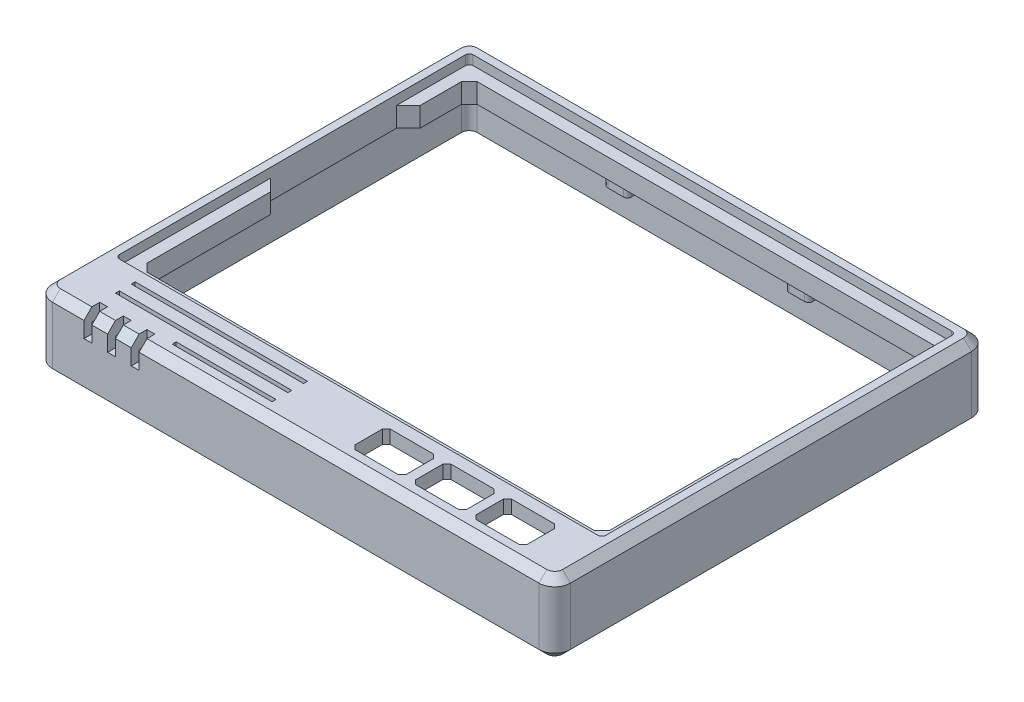
from build123d import *

# Parameters (mm, degrees)
SKETCH_1_W           = 65.76
SKETCH_1_H           = 54.92
EXTRUDE_1_DEPTH      = 9.3
FILLET_1_R           = 2
CUT_EXTRUDE_1_DEPTH  = 1.2
SKETCH_3_W           = 58.75
SKETCH_3_H           = 41.92
CUT_EXTRUDE_2_DEPTH  = 1
CHAMFER_2_SIZE       = 1
SKETCH_7_W           = 2
SKETCH_7_H           = 41.92
CUT_EXTRUDE_5_DEPTH  = 48.162577855
CUT_EXTRUDE_6_DEPTH  = 5.8
SKETCH_10_W          = 1.5
SKETCH_10_H          = 22.23
CUT_EXTRUDE_7_DEPTH  = 1
CHAMFER_8_SIZE       = 3
CHAMFER_9_SIZE       = 1
FILLET_2_R           = 2
CHAMFER_11_SIZE      = 1
FILLET_3_R           = 1
SKETCH_14_W          = 12.681422007
SKETCH_14_H          = 0.5
SKETCH_14_W_2        = 21.88
SKETCH_14_W_3        = 6.5
SKETCH_14_H_2        = 4.5
CUT_EXTRUDE_9_DEPTH  = 48.543545828
CHAMFER_14_SIZE      = 0.5
SKETCH_14_3_W        = 1
SKETCH_14_3_H        = 2
CUT_EXTRUDE_10_DEPTH = 3
CUT_EXTRUDE_11_DEPTH = 1.8
EXTRUDE_3_DEPTH      = 2
FILLET_5_R           = 1
SKETCH_23_R          = 1
CUT_EXTRUDE_14_DEPTH = 2
SKETCH_23_3_W        = 3
SKETCH_23_3_H        = 1.8
SKETCH_23_3_W_2      = 3.5
SKETCH_23_3_H_2      = 1.5
SKETCH_23_3_W_3      = 3.51
EXTRUDE_4_DEPTH      = 1.6
FILLET_7_R           = 0.5
SKETCH_26_W          = 3
SKETCH_26_H          = 1.5
EXTRUDE_6_DEPTH      = 2
CHAMFER_18_SIZE      = 1.5
CUT_EXTRUDE_15_DEPTH = 48.323448204
CHAMFER_19_SIZE      = 1


# Some blends are built 0.0001 mm under size
with BuildPart() as part:
    # 草图1 → 凸台-拉伸1 (new body)
    with BuildSketch(Plane(origin=(0, 0, 0), x_dir=(1, 0, 0), z_dir=(0, 1, 0))):
        with Locations((-0.243849372, -5.353249651)):
            Rectangle(SKETCH_1_W, SKETCH_1_H)
    extrude(amount=-EXTRUDE_1_DEPTH)

    # 圆角1
    fillet_1_edges = [part.edges().sort_by_distance(p)[0] for p in [
        (-33.123849372, -4.65, -22.106750349),
        (32.636150628, -4.65, -22.106750349),
    ]]
    fillet(fillet_1_edges, radius=FILLET_1_R)

    # 草图2 → 切除-拉伸1 (cut)
    with BuildSketch(Plane(origin=(0, 0, 0), x_dir=(1, 0, 0), z_dir=(0, 1, 0))):
        with BuildLine():
            Line((-30.623849372, 20.106750349), (30.126150628, 20.106750349))
            ThreePointArc((30.126150628, 20.106750349), (30.479704018, 19.960303739), (30.626150628, 19.606750349))
            Line((30.626150628, 19.606750349), (30.626150628, -24.313249651))
            ThreePointArc((30.626150628, -24.313249651), (30.479704018, -24.666803042), (30.126150628, -24.813249651))
            Line((30.126150628, -24.813249651), (-30.623849372, -24.813249651))
            ThreePointArc((-30.623849372, -24.813249651), (-30.977402763, -24.666803042), (-31.123849372, -24.313249651))
            Line((-31.123849372, -24.313249651), (-31.123849372, 19.606750349))
            ThreePointArc((-31.123849372, 19.606750349), (-30.977402763, 19.960303739), (-30.623849372, 20.106750349))
        make_face()
    extrude(amount=-CUT_EXTRUDE_1_DEPTH, mode=Mode.SUBTRACT)

    # 草图3 → 切除-拉伸2 (cut)
    with BuildSketch(Plane(origin=(0, -1.2, 0), x_dir=(1, 0, 0), z_dir=(0, 1, 0))):
        with Locations((-0.248849372, -2.353249651)):
            Rectangle(SKETCH_3_W, SKETCH_3_H)
    extrude(amount=-CUT_EXTRUDE_2_DEPTH, mode=Mode.SUBTRACT)

    # 倒角2
    chamfer_2_edges = [part.edges().sort_by_distance(p)[0] for p in [
        (-33.123849372, 0, 6.353249651),
        (-0.243849372, 0, -22.106750349),
        (-32.538062935, 0, -21.520963911),
        (32.05036419, 0, -21.520963911),
        (32.636150628, 0, 6.353249651),
    ]]
    chamfer(chamfer_2_edges, length=CHAMFER_2_SIZE)

    # 草图7 → 切除-拉伸5 (cut, through all)
    with BuildSketch(Plane(origin=(0, -2.2, 0), x_dir=(1, 0, 0), z_dir=(0, 1, 0))):
        with Locations((-28.623849372, -2.353249651)):
            Rectangle(SKETCH_7_W, SKETCH_7_H)
    extrude(amount=-CUT_EXTRUDE_5_DEPTH, mode=Mode.SUBTRACT)

    # 草图8 → 切除-拉伸6 (cut)
    with BuildSketch(Plane.XZ.offset(9.3)):
        with BuildLine():
            Line((-31.123849372, -21.106750349), (30.636150628, -21.106750349))
            ThreePointArc((30.636150628, -21.106750349), (31.343257409, -20.81385713), (31.636150628, -20.106750349))
            Line((31.636150628, -20.106750349), (31.636150628, 31.813249651))
            Line((31.636150628, 31.813249651), (-32.123849372, 31.813249651))
            Line((-32.123849372, 31.813249651), (-32.123849372, -20.106750349))
            ThreePointArc((-32.123849372, -20.106750349), (-31.830956154, -20.81385713), (-31.123849372, -21.106750349))
        make_face()
    extrude(amount=-CUT_EXTRUDE_6_DEPTH, mode=Mode.SUBTRACT)

    # 草图10 → 切除-拉伸7 (cut)
    with BuildSketch(Plane(origin=(0, -1.2, 0), x_dir=(1, 0, 0), z_dir=(0, 1, 0))):
        with Locations((29.876150628, 7.491750349)):
            Rectangle(SKETCH_10_W, SKETCH_10_H)
    extrude(amount=-CUT_EXTRUDE_7_DEPTH, mode=Mode.SUBTRACT)

    # 倒角8
    # the kernel refuses this chamfer: 3 mm, written as the material it takes off along each edge
    with BuildSketch(Plane(origin=(29.126150628, 6.515048964, 3.623249651), x_dir=(0.9996219169112968, 0, -0.027495876610586365), z_dir=(0, -1, 0))) as chamfer_8_piece_1_section:
        Polygon((CHAMFER_8_SIZE * 0.999621916911, CHAMFER_8_SIZE * 0.0274958766106), (-CHAMFER_8_SIZE * 0.0274958766106, CHAMFER_8_SIZE * 0.999621916911), (0, 0), align=None)
    chamfer_8_piece_1 = extrude(amount=8.715048964, mode=Mode.PRIVATE)
    chamfer_8_piece_1 = split(chamfer_8_piece_1, bisect_by=Plane(origin=(30.626150628, -1.7, 4.789916318), z_dir=(-1, 0, 0)), keep=Keep.TOP, mode=Mode.PRIVATE)
    add(chamfer_8_piece_1, mode=Mode.SUBTRACT)

    # 倒角9
    chamfer_9_edges = [part.edges().sort_by_distance(p)[0] for p in [
        (-29.623849372, -2.35, 23.313249651),
        (-29.623849372, -2.35, -18.606750349),
        (29.126150628, -1.7, 23.313249651),
    ]]
    chamfer(chamfer_9_edges, length=CHAMFER_9_SIZE)

    # 圆角2
    fillet_2_edges = [part.edges().sort_by_distance(p)[0] for p in [
        (32.636150628, -5.15, 32.813249651),
        (-33.123849372, -5.15, 32.813249651),
    ]]
    fillet(fillet_2_edges, radius=FILLET_2_R)

    # 倒角11
    chamfer_11_edges = [part.edges().sort_by_distance(p)[0] for p in [
        (-31.641487463, 0, 32.745101304),
        (31.153788718, 0, 32.745101304),
        (-0.243849372, 0, 32.813249651),
    ]]
    chamfer(chamfer_11_edges, length=CHAMFER_11_SIZE - 0.0001)  # a hair under: the kernel refuses the full size

    # 圆角3
    fillet_3_edges = [part.edges().sort_by_distance(p)[0] for p in [
        (-32.123849372, -6.4, 31.813249651),
        (31.636150628, -6.4, 31.813249651),
    ]]
    fillet(fillet_3_edges, radius=FILLET_3_R)

    # 草图14 → 切除-拉伸9 (cut, through all)
    with BuildSketch(Plane(origin=(0, 0, 0), x_dir=(1, 0, 0), z_dir=(0, 1, 0))):
        with Locations((-11.584560376, -30.563249651)):
            Rectangle(SKETCH_14_W, SKETCH_14_H)
        with Locations((-16.183849372, -26.563249651)):
            Rectangle(SKETCH_14_W_2, SKETCH_14_H)
        with Locations((-16.183849372, -28.563249651)):
            Rectangle(SKETCH_14_W_2, SKETCH_14_H)
        with Locations((8.006150628, -28.563249651)):
            Rectangle(SKETCH_14_W_3, SKETCH_14_H_2)
        with Locations((15.696150628, -28.563249651)):
            Rectangle(SKETCH_14_W_3, SKETCH_14_H_2)
        with Locations((23.386150628, -28.563249651)):
            Rectangle(SKETCH_14_W_3, SKETCH_14_H_2)
    extrude(amount=-CUT_EXTRUDE_9_DEPTH, mode=Mode.SUBTRACT)

    # 倒角14
    chamfer_14_edges = [part.edges().sort_by_distance(p)[0] for p in [
        (20.136150628, -1.75, 26.313249651),
        (26.636150628, -1.75, 26.313249651),
        (26.636150628, -1.75, 30.813249651),
        (20.136150628, -1.75, 30.813249651),
        (12.446150628, -1.75, 26.313249651),
        (18.946150628, -1.75, 26.313249651),
        (18.946150628, -1.75, 30.813249651),
        (12.446150628, -1.75, 30.813249651),
        (4.756150628, -1.75, 30.813249651),
        (4.756150628, -1.75, 26.313249651),
        (11.256150628, -1.75, 26.313249651),
        (11.256150628, -1.75, 30.813249651),
    ]]
    chamfer(chamfer_14_edges, length=CHAMFER_14_SIZE)

    # 草图14<3> → 切除-拉伸10 (cut)
    with BuildSketch(Plane(origin=(0, 0, 0), x_dir=(1, 0, 0), z_dir=(0, 1, 0))):
        with Locations((-26.623849372, -31.813249651)):
            Rectangle(SKETCH_14_3_W, SKETCH_14_3_H)
        with Locations((-23.623849372, -31.813249651)):
            Rectangle(SKETCH_14_3_W, SKETCH_14_3_H)
        with Locations((-20.623849372, -31.813249651)):
            Rectangle(SKETCH_14_3_W, SKETCH_14_3_H)
    extrude(amount=-CUT_EXTRUDE_10_DEPTH, mode=Mode.SUBTRACT)

    # 草图19 → 切除-拉伸11 (cut)
    with BuildSketch(Plane.XZ.offset(3.5)):
        with BuildLine():
            Line((30.636150628, 31.813249651), (-31.123849372, 31.813249651))
            ThreePointArc((-31.123849372, 31.813249651), (-31.830956154, 31.520356433), (-32.123849372, 30.813249651))
            Line((-32.123849372, 30.813249651), (-32.123849372, -20.106750349))
            ThreePointArc((-32.123849372, -20.106750349), (-31.830956154, -20.81385713), (-31.123849372, -21.106750349))
            Line((-31.123849372, -21.106750349), (30.636150628, -21.106750349))
            ThreePointArc((30.636150628, -21.106750349), (31.343257409, -20.81385713), (31.636150628, -20.106750349))
            Line((31.636150628, -20.106750349), (31.636150628, 30.813249651))
            ThreePointArc((31.636150628, 30.813249651), (31.343257409, 31.520356433), (30.636150628, 31.813249651))
        make_face()
    extrude(amount=-CUT_EXTRUDE_11_DEPTH, mode=Mode.SUBTRACT)

    # 草图22 → 凸台-拉伸3 (add)
    with BuildSketch(Plane.XZ.offset(1.7)):
        with BuildLine():
            Line((30.626150628, 5.123249651), (30.626150628, -18.606750349))
            Line((30.626150628, -18.606750349), (-28.623849372, -18.606750349))
            Line((-28.623849372, -18.606750349), (-29.623849372, -17.606750349))
            Line((-29.623849372, -17.606750349), (-29.623849372, 22.313249651))
            Line((-29.623849372, 22.313249651), (-28.623849372, 23.313249651))
            Line((-28.623849372, 23.313249651), (-28.623849372, 31.813249651))
            Line((-28.623849372, 31.813249651), (-31.123849372, 31.813249651))
            ThreePointArc((-31.123849372, 31.813249651), (-31.830956154, 31.520356433), (-32.123849372, 30.813249651))
            Line((-32.123849372, 30.813249651), (-32.123849372, -20.106750349))
            ThreePointArc((-32.123849372, -20.106750349), (-31.830956154, -20.81385713), (-31.123849372, -21.106750349))
            Line((-31.123849372, -21.106750349), (30.636150628, -21.106750349))
            ThreePointArc((30.636150628, -21.106750349), (31.343257409, -20.81385713), (31.636150628, -20.106750349))
            Line((31.636150628, -20.106750349), (31.636150628, 30.813249651))
            ThreePointArc((31.636150628, 30.813249651), (31.343257409, 31.520356433), (30.636150628, 31.813249651))
            Line((30.636150628, 31.813249651), (28.126150628, 31.813249651))
            Line((28.126150628, 31.813249651), (28.126150628, 23.313249651))
            Line((28.126150628, 23.313249651), (29.126150628, 22.313249651))
            Line((29.126150628, 22.313249651), (29.126150628, 6.623249651))
            Line((29.126150628, 6.623249651), (30.626150628, 5.123249651))
        make_face()
    extrude(amount=EXTRUDE_3_DEPTH)

    # 圆角5
    fillet_5_edges = [part.edges().sort_by_distance(p)[0] for p in [
        (-28.623849372, -1.7, 27.563249651),
        (28.126150628, -1.7, 27.563249651),
    ]]
    fillet(fillet_5_edges, radius=FILLET_5_R)

    # 草图23 → 切除-拉伸14 (cut)
    with BuildSketch(Plane.XZ.offset(3.7)):
        with Locations(Location((-30.423849372, 30.013249651, 0), (0, 0, 270))):
            Circle(SKETCH_23_R)
        with Locations(Location((-30.423849372, -19.306750349, 0), (0, 0, 270))):
            Circle(SKETCH_23_R)
        with Locations(Location((29.926150628, 30.013249651, 0), (0, 0, 270))):
            Circle(SKETCH_23_R)
    extrude(amount=-CUT_EXTRUDE_14_DEPTH, mode=Mode.SUBTRACT)

    # 草图23<3> → 凸台-拉伸4 (add)
    with BuildSketch(Plane.XZ.offset(3.7)):
        with Locations((-11.743849372, -20.206750349)):
            Rectangle(SKETCH_23_3_W, SKETCH_23_3_H)
        with Locations((-30.373849372, 24.063249651)):
            Rectangle(SKETCH_23_3_W_2, SKETCH_23_3_H_2)
        with Locations((29.881150628, 24.063249651)):
            Rectangle(SKETCH_23_3_W_3, SKETCH_23_3_H_2)
        with Locations((11.256150628, -20.206750349)):
            Rectangle(SKETCH_23_3_W, SKETCH_23_3_H)
    extrude(amount=EXTRUDE_4_DEPTH)

    # 圆角7
    fillet_7_edges = [part.edges().sort_by_distance(p)[0] for p in [
        (28.126150628, -4.5, 24.813249651),
        (-28.623849372, -4.5, 24.813249651),
        (-13.243849372, -4.5, -19.306750349),
        (-10.243849372, -4.5, -19.306750349),
        (9.756150628, -4.5, -19.306750349),
        (12.756150628, -4.5, -19.306750349),
    ]]
    fillet(fillet_7_edges, radius=FILLET_7_R)

    # 草图26 → 凸台-拉伸6 (add)
    with BuildSketch(Plane.XZ.offset(1.7)):
        with Locations((-0.243849372, 31.063249651)):
            Rectangle(SKETCH_26_W, SKETCH_26_H)
    extrude(amount=EXTRUDE_6_DEPTH)

    # 倒角18
    chamfer_18_edges = [part.edges().sort_by_distance(p)[0] for p in [
        (1.256150628, -2.7, 31.813249651),
        (-1.743849372, -2.7, 31.813249651),
    ]]
    chamfer(chamfer_18_edges, length=CHAMFER_18_SIZE - 0.0001)  # a hair under: the kernel refuses the full size

    # 草图28 → 切除-拉伸15 (cut, through all)
    with BuildSketch(Plane(origin=(0, -1.2, 0), x_dir=(1, 0, 0), z_dir=(0, 1, 0))):
        Polygon((-31.123849372, -5.123249651), (-29.623849372, -6.623249651), (-29.623849372, 12.376750349), (-31.123849372, 10.876750349), align=None)
    extrude(amount=-CUT_EXTRUDE_15_DEPTH, mode=Mode.SUBTRACT)

    # 倒角19
    chamfer_19_edges = [part.edges().sort_by_distance(p)[0] for p in [
        (-0.243849372, -9.3, 32.813249651),
        (32.636150628, -9.3, 5.353249651),
        (-32.538062935, -9.3, 32.227463214),
        (32.05036419, -9.3, 32.227463214),
        (-0.243849372, -9.3, -22.106750349),
        (-33.123849372, -9.3, 5.353249651),
        (-32.538062935, -9.3, -21.520963911),
        (32.05036419, -9.3, -21.520963911),
    ]]
    chamfer(chamfer_19_edges, length=CHAMFER_19_SIZE - 0.0001)  # a hair under: the kernel refuses the full size


solid = part.part
